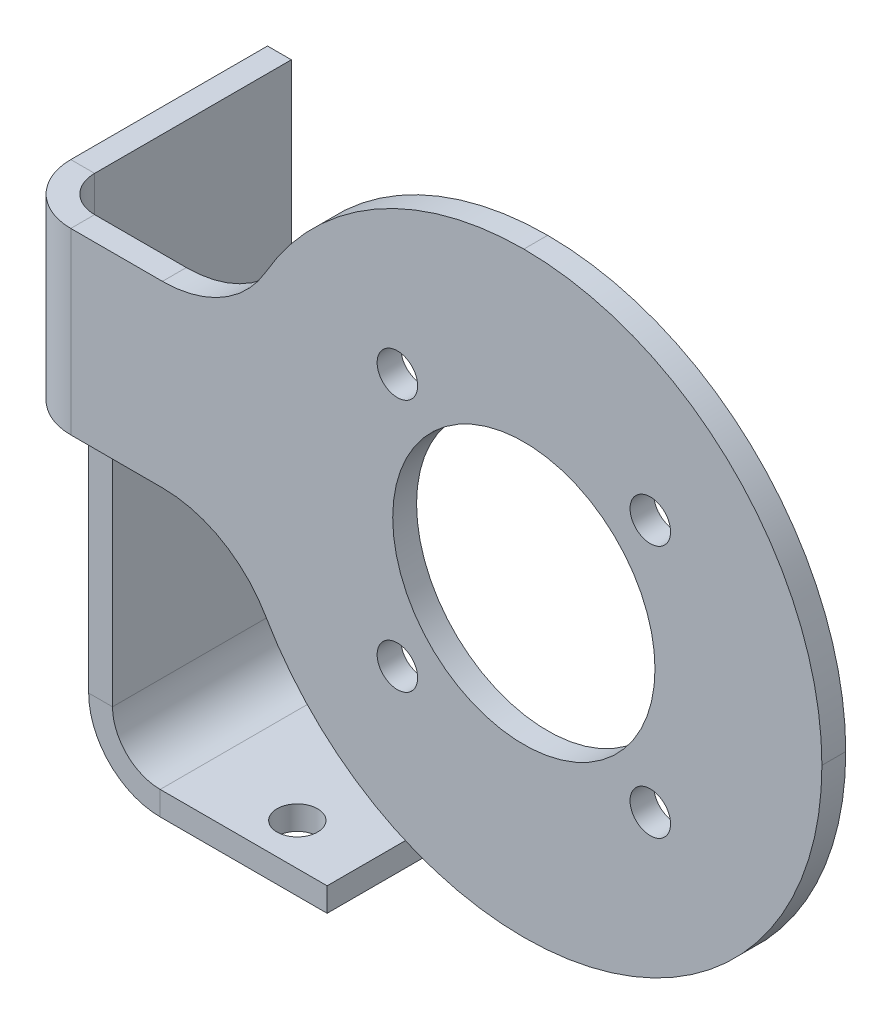
from build123d import *

# Parameters (mm, degrees)
BOSS_EXTRUDE1_DEPTH  = 50
SKETCH4_R            = 11
CUT_EXTRUDE1_DEPTH   = 88.099081511
BOSS_EXTRUDE2_DEPTH  = 15
M3_CLEARANCE_HOLE2_D = 3.4
CUT_EXTRUDE2_START   = -6.5
CUT_EXTRUDE2_DEPTH   = 6.5
CUT_EXTRUDE3_START   = -21.5
CUT_EXTRUDE3_DEPTH   = 21.5
FILLET1_R            = 25
FILLET2_R            = 10
CONVERT_SOLID1_START = -21.5
CONVERT_SOLID1_DEPTH = 15
M3_CLEARANCE_HOLE3_D = 3.4


# Read off the part's stored shape, not the designer's step: Convert-Solid1
with BuildPart() as part:
    # Sketch2 → Boss-Extrude1 (new body)
    with BuildSketch(Plane(origin=(0, 0, 0), x_dir=(1, 0, 0), z_dir=(0, 1, 0))):
        with BuildLine():
            Line((0, 0), (-63, 0))
            ThreePointArc((-63, 0), (-66.535533906, 1.464466094), (-68, 5))
            Line((-68, 5), (-68, 21.5))
            Line((-68, 21.5), (-66, 21.5))
            Line((-66, 21.5), (-66, 5))
            ThreePointArc((-66, 5), (-65.121320344, 2.878679656), (-63, 2))
            Line((-63, 2), (0, 2))
            Line((0, 2), (0, 0))
        make_face()
    extrude(amount=BOSS_EXTRUDE1_DEPTH)

    # Sketch4 → Cut-Extrude1 (cut, through all)
    with BuildSketch(Plane.XY):
        with Locations((-25, 25)):
            Circle(SKETCH4_R)
    extrude(amount=-CUT_EXTRUDE1_DEPTH, mode=Mode.SUBTRACT)

    # Sketch3 → Boss-Extrude2 (add)
    with BuildSketch(Plane(origin=(0, 0, -21.5), x_dir=(-1, 0, 0), z_dir=(0, 0, -1))):
        with BuildLine():
            Line((66, 0), (66, -7))
            ThreePointArc((66, -7), (64.828427125, -9.828427125), (62, -11))
            Line((62, -11), (48, -11))
            Line((48, -11), (48, -13))
            Line((48, -13), (63, -13))
            ThreePointArc((63, -13), (66.535533906, -11.535533906), (68, -8))
            Line((68, -8), (68, 0))
            Line((68, 0), (66, 0))
        make_face()
    extrude(amount=-BOSS_EXTRUDE2_DEPTH)

    # M3 Clearance Hole2 (through all)
    with Locations(Plane.XY):
        with Locations((-35.606601718, 14.393398282), (-35.606601718, 35.606601718), (-14.393398282, 35.606601718), (-14.393398282, 14.393398282)):
            Hole(M3_CLEARANCE_HOLE2_D / 2)

    # Sketch8 → Cut-Extrude2 (cut)
    with BuildSketch(Plane.XY.offset(CUT_EXTRUDE2_START)):
        with BuildLine():
            Line((-25, 0), (-68, 0))
            Line((-68, 0), (-68, 17.5))
            Line((-68, 17.5), (-48.848480035, 17.5))
            ThreePointArc((-48.848480035, 17.5), (-39.790199458, 4.844355629), (-25, 0))
        make_face()
    extrude(amount=CUT_EXTRUDE2_DEPTH, mode=Mode.SUBTRACT)

    # Sketch9 → Cut-Extrude3 (cut)
    with BuildSketch(Plane.XY.offset(CUT_EXTRUDE3_START)):
        with BuildLine():
            Line((-25, 50), (-68, 50))
            Line((-68, 50), (-68, 32.5))
            Line((-68, 32.5), (-48.848480035, 32.5))
            ThreePointArc((-48.848480035, 32.5), (-39.790199458, 45.155644371), (-25, 50))
        make_face()
    extrude(amount=CUT_EXTRUDE3_DEPTH, mode=Mode.SUBTRACT)

    # Fillet1
    fillet1_edges = [part.edges().sort_by_distance(p)[0] for p in [
        (0, 0, -1),
        (0, 50, -1),
    ]]
    fillet(fillet1_edges, radius=FILLET1_R - 0.0001)  # a hair under: the kernel refuses the full size

    # Fillet2
    fillet2_edges = [part.edges().sort_by_distance(p)[0] for p in [
        (-48.848480035, 32.5, -1),
        (-48.848480035, 17.5, -1),
    ]]
    fillet(fillet2_edges, radius=FILLET2_R)

    # Convert-Solid1 outline → Convert-Solid1 (cut)
    with BuildSketch(Plane.XY.offset(CONVERT_SOLID1_START)):
        with BuildLine():
            Line((-63, -13), (-62, -13))
            ThreePointArc((-62, -13), (-66.242640687, -11.242640687), (-68, -7))
            Line((-68, -7), (-68, -8))
            ThreePointArc((-68, -8), (-66.535533906, -11.535533906), (-63, -13))
        make_face()
    extrude(amount=CONVERT_SOLID1_DEPTH, mode=Mode.SUBTRACT)

    # M3 Clearance Hole3 (through all)
    with Locations(Plane(origin=(0, -11, 0), x_dir=(1, 0, 0), z_dir=(0, 1, 0))):
        with Locations((-54, 10), (-54, 18)):
            Hole(M3_CLEARANCE_HOLE3_D / 2)


solid = part.part
